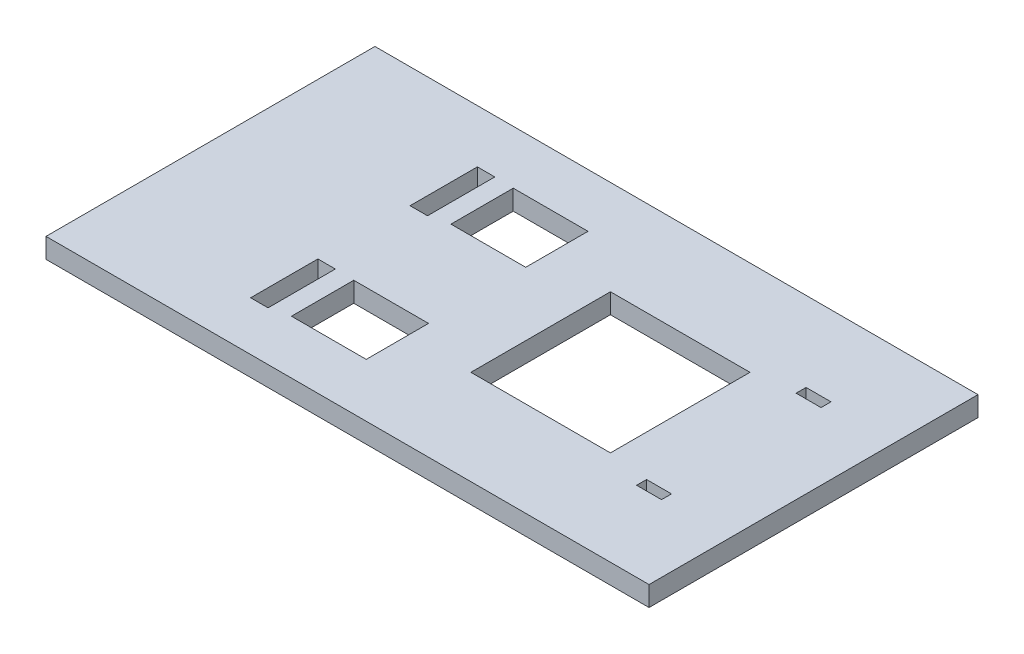
from build123d import *

# Parameters (mm, degrees)
SKETCH1_W           = 121
SKETCH1_H           = 66
BOSS_EXTRUDE1_DEPTH = 4
SKETCH2_W           = 28
SKETCH2_H           = 28
SKETCH2_W_2         = 15
SKETCH2_H_2         = 12.5
CUT_EXTRUDE1_DEPTH  = 138.887635414
SKETCH3_W           = 5
SKETCH3_H           = 2
CUT_EXTRUDE2_DEPTH  = 138.887635414
SKETCH4_W           = 3.5
SKETCH4_H           = 13.5
CUT_EXTRUDE3_DEPTH  = 138.887635414


with BuildPart() as part:
    # Sketch1 → Boss-Extrude1 (new body)
    with BuildSketch(Plane(origin=(0, 0, 0), x_dir=(1, 0, 0), z_dir=(0, 1, 0))):
        with Locations((60.5, -33)):
            Rectangle(SKETCH1_W, SKETCH1_H)
    extrude(amount=BOSS_EXTRUDE1_DEPTH)

    # Sketch2 → Cut-Extrude1 (cut, through all)
    with BuildSketch(Plane(origin=(0, 4, 0), x_dir=(1, 0, 0), z_dir=(0, 1, 0))):
        with Locations((80.25, -33)):
            Rectangle(SKETCH2_W, SKETCH2_H)
        with Locations((46, -17)):
            Rectangle(SKETCH2_W_2, SKETCH2_H_2)
        with Locations((46, -49)):
            Rectangle(SKETCH2_W_2, SKETCH2_H_2)
    extrude(amount=-CUT_EXTRUDE1_DEPTH, mode=Mode.SUBTRACT)

    # Sketch3 → Cut-Extrude2 (cut, through all)
    with BuildSketch(Plane.XZ):
        with Locations((105, 49)):
            Rectangle(SKETCH3_W, SKETCH3_H)
        with Locations((105, 17)):
            Rectangle(SKETCH3_W, SKETCH3_H)
    extrude(amount=-CUT_EXTRUDE2_DEPTH, mode=Mode.SUBTRACT)

    # Sketch4 → Cut-Extrude3 (cut, through all)
    with BuildSketch(Plane(origin=(0, 4, 0), x_dir=(1, 0, 0), z_dir=(0, 1, 0))):
        with Locations((32.95, -49.395895757)):
            Rectangle(SKETCH4_W, SKETCH4_H)
        with Locations((32.95, -17.399625311)):
            Rectangle(SKETCH4_W, SKETCH4_H)
    extrude(amount=-CUT_EXTRUDE3_DEPTH, mode=Mode.SUBTRACT)


solid = part.part
